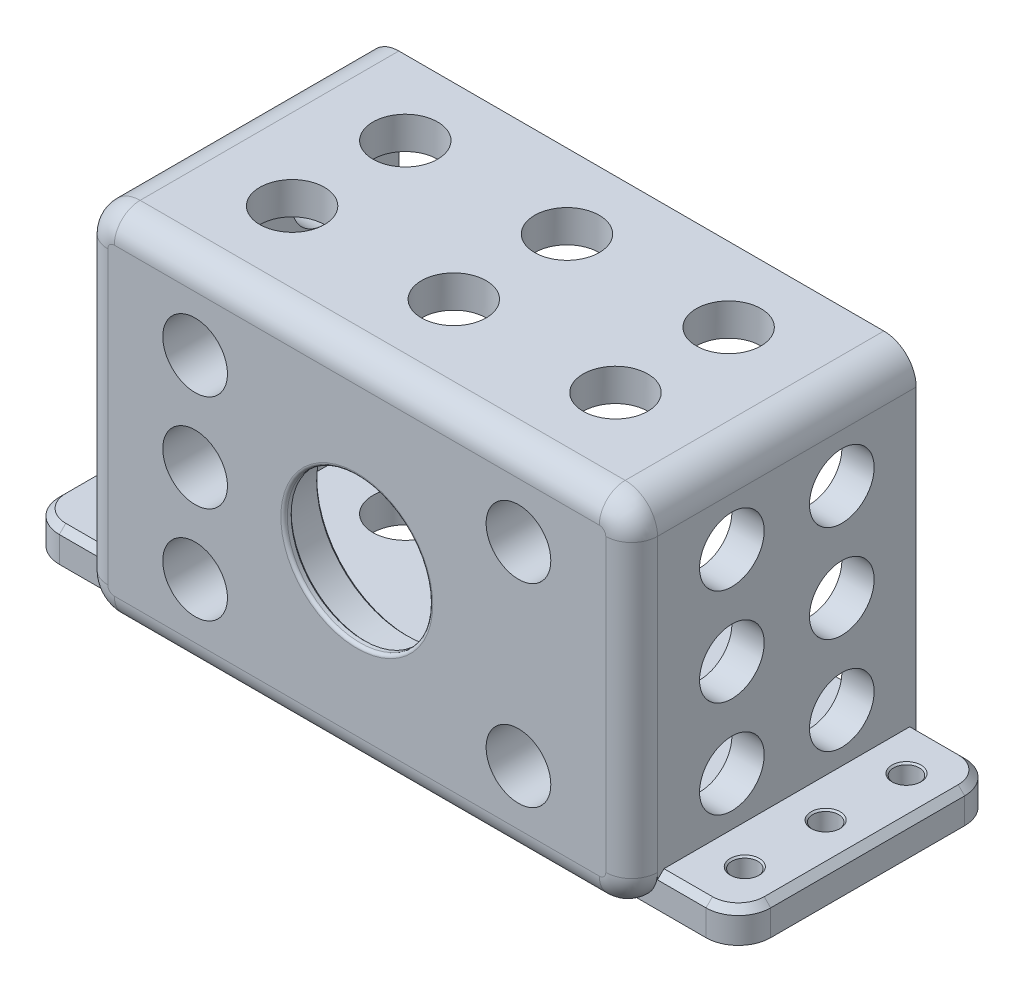
from build123d import *

# Parameters (mm, degrees)
SKETCH1_W           = 170
SKETCH1_H           = 110
BOSS_EXTRUDE1_DEPTH = 88
FILLET1_R           = 10
SHELL1_START        = -75
SHELL1_OUTLINE_W    = 90
SHELL1_OUTLINE_H    = 72
SHELL1_DEPTH        = 150
SKETCH2_R           = 22.5
CUT_EXTRUDE1_DEPTH  = 135.141716107
SKETCH3_R           = 27.6
CUT_EXTRUDE2_DEPTH  = 13
FILLET2_R           = 8
SKETCH5_R           = 13.1
CUT_EXTRUDE3_DEPTH  = 8
SKETCH6_R           = 10.1
CUT_EXTRUDE4_DEPTH  = 0.8
CHAMFER1_SIZE       = 0.8
FILLET3_R           = 1
SKETCH7_W           = 35
SKETCH7_H           = 80
BOSS_EXTRUDE2_DEPTH = 10
FILLET5_R           = 10
CHAMFER2_SIZE       = 2
SKETCH8_R           = 4
CUT_EXTRUDE5_DEPTH  = 173.754160587
CHAMFER3_SIZE       = 0.5
SKETCH9_R           = 3.2
CUT_EXTRUDE6_DEPTH  = 12
SKETCH10_R          = 3.25
CUT_EXTRUDE7_DEPTH  = 12
CHAMFER4_SIZE       = 0.6
SKETCH11_R          = 10
CUT_EXTRUDE8_DEPTH  = 143.509648796
SKETCH12_R          = 10
CUT_EXTRUDE9_DEPTH  = 221.893639564
SKETCH13_R          = 10
CUT_EXTRUDE12_DEPTH = 179.728844902


# Read off the part's stored shape, not the designer's step: Shell1
# Some blends are built 0.0001 mm under size
with BuildPart() as part:
    # Sketch1 → Boss-Extrude1 (new body)
    with BuildSketch(Plane.XY):
        Rectangle(SKETCH1_W, SKETCH1_H)
    extrude(amount=BOSS_EXTRUDE1_DEPTH)

    # Fillet1
    fillet1_edges = [part.edges().sort_by_distance(p)[0] for p in [
        (85, -55, 44),
        (-85, -55, 44),
        (-85, 55, 44),
        (85, 55, 44),
    ]]
    fillet(fillet1_edges, radius=FILLET1_R)

    # Shell1 outline → Shell1 (cut)
    with BuildSketch(Plane.YZ.offset(SHELL1_START)):
        with Locations((0, 36)):
            Rectangle(SHELL1_OUTLINE_W, SHELL1_OUTLINE_H)
    extrude(amount=SHELL1_DEPTH, mode=Mode.SUBTRACT)

    # Sketch2 → Cut-Extrude1 (cut, through all)
    with BuildSketch(Plane.XY.offset(88)):
        Circle(SKETCH2_R)
    extrude(amount=-CUT_EXTRUDE1_DEPTH, mode=Mode.SUBTRACT)

    # Sketch3 → Cut-Extrude2 (cut)
    with BuildSketch(Plane(origin=(0, 0, 72), x_dir=(-1, 0, 0), z_dir=(0, 0, -1))):
        Circle(SKETCH3_R)
    extrude(amount=-CUT_EXTRUDE2_DEPTH, mode=Mode.SUBTRACT)

    # Fillet2
    fillet2_edges = [part.edges().sort_by_distance(p)[0] for p in [
        (0, -55, 88),
        (-85, 0, 88),
        (85, 0, 88),
        (0, 55, 88),
        (-82.071067812, 52.071067812, 88),
        (82.071067812, 52.071067812, 88),
        (82.071067812, -52.071067812, 88),
        (-82.071067812, -52.071067812, 88),
    ]]
    fillet(fillet2_edges, radius=FILLET2_R)

    # Sketch5 → Cut-Extrude3 (cut)
    with BuildSketch(Plane(origin=(0, 0, 72), x_dir=(-1, 0, 0), z_dir=(0, 0, -1))):
        with Locations((-50, 0)):
            Circle(SKETCH5_R)
    extrude(amount=-CUT_EXTRUDE3_DEPTH, mode=Mode.SUBTRACT)

    # Sketch6 → Cut-Extrude4 (cut)
    with BuildSketch(Plane(origin=(0, 0, 80), x_dir=(-1, 0, 0), z_dir=(0, 0, -1))):
        with Locations((-50, 0)):
            Circle(SKETCH6_R)
    extrude(amount=-CUT_EXTRUDE4_DEPTH, mode=Mode.SUBTRACT)

    # Chamfer1
    chamfer1_edges = [part.edges().sort_by_distance(p)[0] for p in [
        (27.6, 0, 72),
        (-22.5, 0, 85),
        (63.1, 0, 72),
        (60.1, 0, 80),
    ]]
    chamfer(chamfer1_edges, length=CHAMFER1_SIZE - 0.0001)  # a hair under: the kernel refuses the full size

    # Fillet3
    fillet3_edges = [part.edges().sort_by_distance(p)[0] for p in [
        (-22.5, 0, 88),
    ]]
    fillet(fillet3_edges, radius=FILLET3_R)

    # Sketch7 → Boss-Extrude2 (add)
    with BuildSketch(Plane.XZ.offset(55)):
        with Locations((-92.5, 40)):
            Rectangle(SKETCH7_W, SKETCH7_H)
        with Locations((92.5, 40)):
            Rectangle(SKETCH7_W, SKETCH7_H)
    extrude(amount=-BOSS_EXTRUDE2_DEPTH)

    # Fillet5
    fillet5_edges = [part.edges().sort_by_distance(p)[0] for p in [
        (-110, -50, 80),
        (-110, -50, 0),
        (110, -50, 0),
        (110, -50, 80),
    ]]
    fillet(fillet5_edges, radius=FILLET5_R)

    # Chamfer2
    # the kernel refuses this chamfer: 2 mm, written as the material it takes off along each edge
    with BuildSketch(Plane(origin=(85, -45, 0), x_dir=(0, -0.9996219169112968, -0.02749587661058639), z_dir=(1, 0, 0)), Plane(origin=(-100, -45, 0), x_dir=(0, -0.9996219169112968, -0.02749587661058639), z_dir=(1, 0, 0))) as chamfer2_piece_1:
        Polygon((CHAMFER2_SIZE * 0.999621916911, -CHAMFER2_SIZE * 0.0274958766106), (-CHAMFER2_SIZE * 0.0274958766106, -CHAMFER2_SIZE * 0.999621916911), (0, 0), align=None)
    extrude(amount=15, mode=Mode.SUBTRACT)
    with BuildSketch(Plane(origin=(100, -45, 80), x_dir=(0, 0.02749587661058555, -0.9996219169112968), z_dir=(-1, 0, 0)), Plane(origin=(-85, -45, 80), x_dir=(0, 0.02749587661058555, -0.9996219169112968), z_dir=(-1, 0, 0))) as chamfer2_piece_2:
        Polygon((CHAMFER2_SIZE * 0.999621916911, CHAMFER2_SIZE * 0.0274958766106), (-CHAMFER2_SIZE * 0.0274958766106, CHAMFER2_SIZE * 0.999621916911), (0, 0), align=None)
    extrude(amount=15, mode=Mode.SUBTRACT)
    with BuildSketch(Plane(origin=(110, -45, 10), x_dir=(-0.9996219169112968, 0.02749587661058555, 0), z_dir=(0, 0, 1)), Plane(origin=(-110, -45, 70), x_dir=(0.9996219169112968, 0.02749587661058555, 0), z_dir=(0, 0, -1))) as chamfer2_piece_3:
        Polygon((CHAMFER2_SIZE * 0.999621916911, CHAMFER2_SIZE * 0.0274958766106), (-CHAMFER2_SIZE * 0.0274958766106, CHAMFER2_SIZE * 0.999621916911), (0, 0), align=None)
    extrude(amount=60, mode=Mode.SUBTRACT)
    with BuildSketch(Plane(origin=(100, -45, 70), x_dir=(1, 0, 0), z_dir=(0, 0, -1))) as chamfer2_piece_4:
        Polygon((10 - CHAMFER2_SIZE, 0), (10, CHAMFER2_SIZE), (10, 0), align=None)
    revolve(axis=Axis((100, -45, 70), (0, -1, 0)), revolution_arc=90, mode=Mode.SUBTRACT)
    with BuildSketch(Plane(origin=(100, -45, 10), x_dir=(0, 0, -1), z_dir=(-1, 0, 0))) as chamfer2_piece_5:
        Polygon((10, CHAMFER2_SIZE), (10 - CHAMFER2_SIZE, 0), (10, 0), align=None)
    revolve(axis=Axis((100, -45, 10), (0, -1, 0)), revolution_arc=90, mode=Mode.SUBTRACT)
    with BuildSketch(Plane(origin=(-100, -45, 70), x_dir=(0, 0, 1), z_dir=(1, 0, 0))) as chamfer2_piece_6:
        Polygon((10 - CHAMFER2_SIZE, 0), (10, CHAMFER2_SIZE), (10, 0), align=None)
    revolve(axis=Axis((-100, -45, 70), (0, -1, 0)), revolution_arc=90, mode=Mode.SUBTRACT)
    with BuildSketch(Plane(origin=(-100, -45, 10), x_dir=(0, 0, -1), z_dir=(1, 0, 0))) as chamfer2_piece_7:
        Polygon((10, -CHAMFER2_SIZE), (10 - CHAMFER2_SIZE, 0), (10, 0), align=None)
    revolve(axis=Axis((-100, -45, 10), (0, 1, 0)), revolution_arc=90, mode=Mode.SUBTRACT)

    # Sketch8 → Cut-Extrude5 (cut, through all)
    with BuildSketch(Plane(origin=(0, -45, 0), x_dir=(1, 0, 0), z_dir=(0, 1, 0))):
        with Locations(Location((-97, -40, 0), (0, 0, 270))):
            Circle(SKETCH8_R)
        with Locations(Location((-97, -15, 0), (0, 0, 270))):
            Circle(SKETCH8_R)
        with Locations(Location((-97, -65, 0), (0, 0, 270))):
            Circle(SKETCH8_R)
    cut_extrude5 = extrude(amount=-CUT_EXTRUDE5_DEPTH, mode=Mode.SUBTRACT)

    # Mirror4: Cut-Extrude5 across plane
    add(cut_extrude5.mirror(Plane(origin=(0, 0, 0), x_dir=(0, 0, 1), z_dir=(1, 0, 0))), mode=Mode.SUBTRACT)

    # Chamfer3
    chamfer3_edges = [part.edges().sort_by_distance(p)[0] for p in [
        (-97, -45, 61),
        (-97, -45, 11),
        (-97, -45, 36),
        (97, -45, 61),
        (97, -45, 11),
        (97, -45, 36),
    ]]
    chamfer(chamfer3_edges, length=CHAMFER3_SIZE)

    # Sketch9 → Cut-Extrude6 (cut)
    with BuildSketch(Plane(origin=(0, 0, 0), x_dir=(-1, 0, 0), z_dir=(0, 0, -1))):
        with Locations((0, 50)):
            Circle(SKETCH9_R)
        with Locations((-50, 50)):
            Circle(SKETCH9_R)
        with Locations(Location((50, 50, 0), (0, 0, 180))):
            Circle(SKETCH9_R)
    cut_extrude6 = extrude(amount=-CUT_EXTRUDE6_DEPTH, mode=Mode.SUBTRACT)

    # Mirror5: Cut-Extrude6 across plane
    add(cut_extrude6.mirror(Plane.ZX), mode=Mode.SUBTRACT)

    # Sketch10 → Cut-Extrude7 (cut)
    with BuildSketch(Plane(origin=(0, 0, 0), x_dir=(-1, 0, 0), z_dir=(0, 0, -1))):
        with Locations((-80, 0)):
            Circle(SKETCH10_R)
        with Locations((-80, 40)):
            Circle(SKETCH10_R)
        with Locations(Location((-80, -40, 0), (0, 0, 180))):
            Circle(SKETCH10_R)
    cut_extrude7 = extrude(amount=-CUT_EXTRUDE7_DEPTH, mode=Mode.SUBTRACT)

    # Mirror6: Cut-Extrude7 across plane
    add(cut_extrude7.mirror(Plane(origin=(0, 0, 0), x_dir=(0, 0, 1), z_dir=(1, 0, 0))), mode=Mode.SUBTRACT)

    # Chamfer4
    chamfer4_edges = [part.edges().sort_by_distance(p)[0] for p in [
        (-53.2, 50, 0),
        (53.2, 50, 0),
        (3.2, 50, 0),
        (-53.2, -50, 0),
        (53.2, -50, 0),
        (3.2, -50, 0),
        (76.75, -40, 0),
        (83.25, 40, 0),
        (83.25, 0, 0),
        (-76.75, -40, 0),
        (-83.25, 40, 0),
        (-83.25, 0, 0),
    ]]
    chamfer(chamfer4_edges, length=CHAMFER4_SIZE)

    # Sketch11 → Cut-Extrude8 (cut, through all)
    with BuildSketch(Plane(origin=(0, 0, 72), x_dir=(-1, 0, 0), z_dir=(0, 0, -1))):
        Circle(SKETCH11_R)
        with Locations((50, 0)):
            Circle(SKETCH11_R)
        with Locations((50, 30)):
            Circle(SKETCH11_R)
        with Locations((50, -30)):
            Circle(SKETCH11_R)
        with Locations(Location((-50, -30, 0), (0, 0, 180))):
            Circle(SKETCH11_R)
        with Locations(Location((-50, 30, 0), (0, 0, 180))):
            Circle(SKETCH11_R)
    extrude(amount=-CUT_EXTRUDE8_DEPTH, mode=Mode.SUBTRACT)

    # Sketch12 → Cut-Extrude9 (cut, through all)
    with BuildSketch(Plane.ZY.offset(85)):
        with Locations(Location((23, 0, 0), (0, 0, 270))):
            Circle(SKETCH12_R)
        with Locations(Location((23, 30, 0), (0, 0, 270))):
            Circle(SKETCH12_R)
        with Locations(Location((23, -30, 0), (0, 0, 270))):
            Circle(SKETCH12_R)
        with Locations(Location((57, -30, 0), (0, 0, 90))):
            Circle(SKETCH12_R)
        with Locations(Location((57, 0, 0), (0, 0, 90))):
            Circle(SKETCH12_R)
        with Locations(Location((57, 30, 0), (0, 0, 90))):
            Circle(SKETCH12_R)
    extrude(amount=-CUT_EXTRUDE9_DEPTH, mode=Mode.SUBTRACT)

    # Sketch13 → Cut-Extrude12 (cut, through all)
    with BuildSketch(Plane(origin=(0, 55, 0), x_dir=(1, 0, 0), z_dir=(0, 1, 0))):
        with Locations(Location((-50, -23, 0), (0, 0, 270))):
            Circle(SKETCH13_R)
        with Locations(Location((-50, -58, 0), (0, 0, 270))):
            Circle(SKETCH13_R)
        with Locations(Location((0, -23, 0), (0, 0, 270))):
            Circle(SKETCH13_R)
        with Locations(Location((0, -58, 0), (0, 0, 270))):
            Circle(SKETCH13_R)
        with Locations(Location((50, -23, 0), (0, 0, 270))):
            Circle(SKETCH13_R)
        with Locations(Location((50, -58, 0), (0, 0, 270))):
            Circle(SKETCH13_R)
    extrude(amount=-CUT_EXTRUDE12_DEPTH, mode=Mode.SUBTRACT)


solid = part.part
